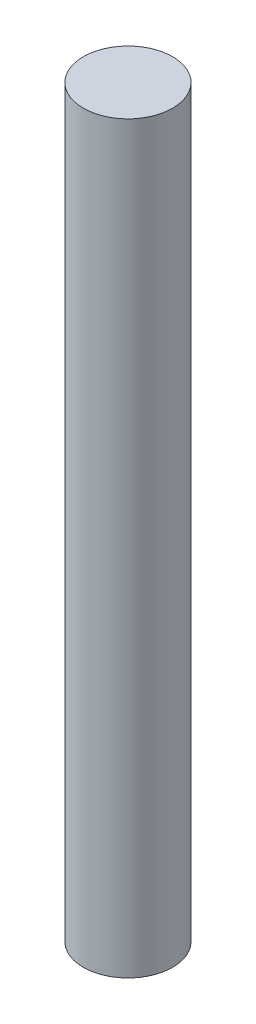
from build123d import *

# Parameters (mm, degrees)
SKETCH_1_R      = 1.5
EXTRUDE_1_DEPTH = 25


with BuildPart() as part:
    # 草图1 → 凸台-拉伸1 (new body)
    with BuildSketch(Plane(origin=(0, 0, 0), x_dir=(1, 0, 0), z_dir=(0, 1, 0))):
        Circle(SKETCH_1_R)
    extrude(amount=EXTRUDE_1_DEPTH)


solid = part.part
